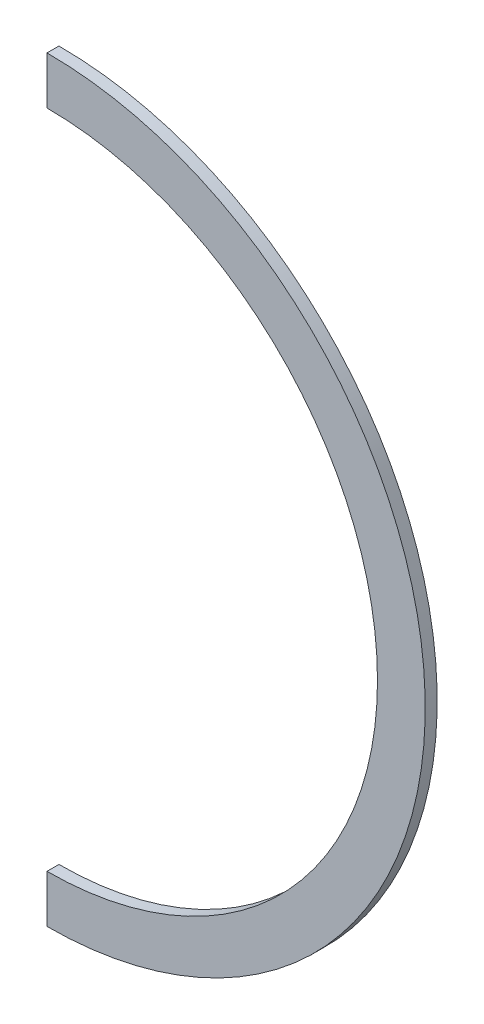
from build123d import *

# Parameters (mm, degrees)
BOSS_EXTRUDE1_DEPTH = 3.175
SKETCH3_W           = 149.303507008
SKETCH3_H           = 288.678903575
CUT_EXTRUDE1_DEPTH  = 147.667755045


with BuildPart() as part:
    # Sketch2 → Boss-Extrude1 (new body)
    with BuildSketch(Plane.XY):
        with BuildLine():
            ThreePointArc((-1.783927604, 106.664181958), (-86.289926541, 57.796410124), (-89.548347912, -39.767444199))
            ThreePointArc((-89.548347912, -39.767444199), (-89.139366423, -40.557656379), (-88.723411943, -41.344220438))
            ThreePointArc((-88.723411943, -41.344220438), (-88.300763494, -42.126623343), (-87.87121564, -42.905259753))
            ThreePointArc((-87.87121564, -42.905259753), (0, -94.523651503), (87.87121564, -42.905259753))
            ThreePointArc((87.87121564, -42.905259753), (88.300763494, -42.126623343), (88.723411943, -41.344220438))
            ThreePointArc((88.723411943, -41.344220438), (89.139366423, -40.557656379), (89.548347912, -39.767444199))
            ThreePointArc((89.548347912, -39.767444199), (86.289926541, 57.796410124), (1.783927604, 106.664181958))
            ThreePointArc((1.783927604, 106.664181958), (0.891998866, 106.676045412), (0, 106.68))
            ThreePointArc((0, 106.68), (-0.891998866, 106.676045412), (-1.783927604, 106.664181958))
        make_face()
        with BuildLine():
            ThreePointArc((-7.652045127, 93.646303016), (0, -81.823651503), (7.652045127, 93.646303016))
            ThreePointArc((7.652045127, 93.646303016), (4.717664566, 93.853310885), (1.778000524, 93.962016248))
            ThreePointArc((1.778000524, 93.962016248), (0.889045735, 93.975503947), (0, 93.98))
            ThreePointArc((0, 93.98), (-0.889045735, 93.975503947), (-1.778000524, 93.962016248))
            ThreePointArc((-1.778000524, 93.962016248), (-4.717664566, 93.853310885), (-7.652045127, 93.646303016))
        make_face(mode=Mode.SUBTRACT)
    extrude(amount=-BOSS_EXTRUDE1_DEPTH)


with BuildPart() as body_2:
    # Split1: the piece on the far side of the plane
    add(part.part)
    split(bisect_by=Plane(origin=(0, 0, 0), x_dir=(0, 0, 1), z_dir=(1, 0, 0)), keep=Keep.BOTTOM)

    # Sketch3 → Cut-Extrude1 (cut, through all)
    with BuildSketch(Plane(origin=(0, 0, 0), x_dir=(0, 0, -1), z_dir=(1, 0, 0))):
        with Locations((2.160275602, 8.369276658)):
            Rectangle(SKETCH3_W, SKETCH3_H)
    extrude(amount=-CUT_EXTRUDE1_DEPTH, mode=Mode.SUBTRACT)


with BuildPart() as part_1:
    add(part.part)

    # Split1
    split(bisect_by=Plane(origin=(0, 0, 0), x_dir=(0, 0, 1), z_dir=(1, 0, 0)), keep=Keep.TOP)


solid = part_1.part
